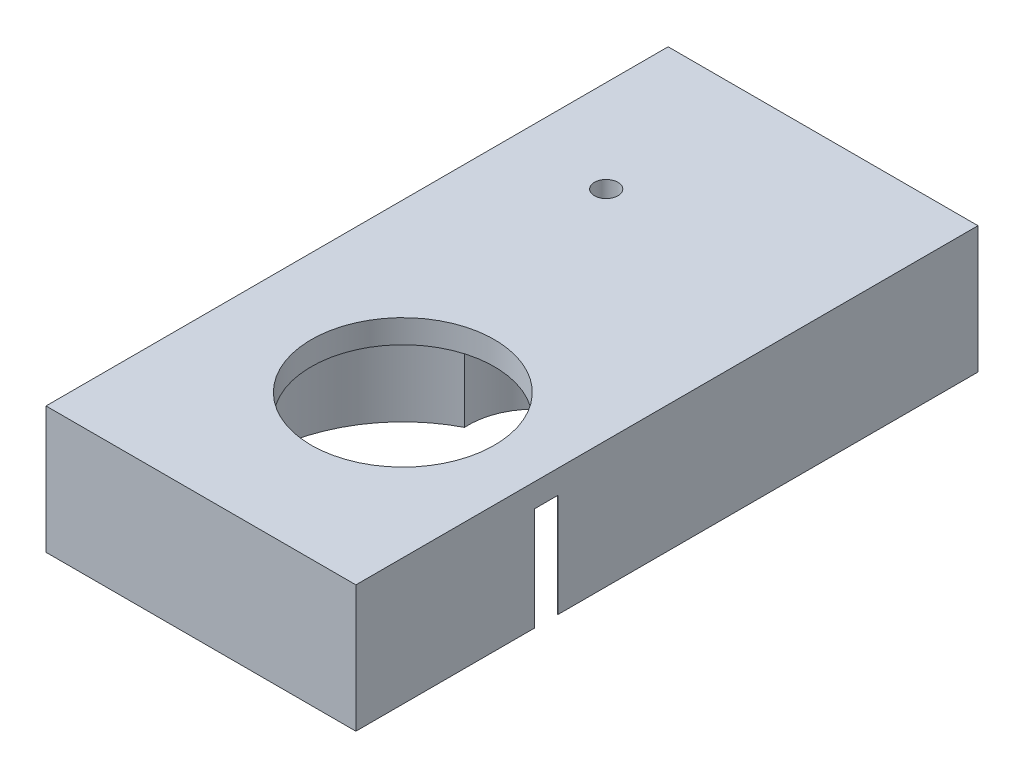
from build123d import *

# Parameters (mm, degrees)
BOSS_EXTRUDE1_DEPTH = 4.4
SKETCH2_R           = 0.5
CUT_EXTRUDE1_DEPTH  = 28.72093072
BOSS_EXTRUDE5_START = 1
SKETCH5_W           = 13.2
SKETCH5_H           = 26.5
SKETCH5_R           = 0.5
SKETCH5_R_2         = 3.9
BOSS_EXTRUDE5_DEPTH = 1


with BuildPart() as part:
    # Sketch1 → Boss-Extrude1 (new body)
    with BuildSketch(Plane(origin=(0, 0, 0), x_dir=(1, 0, 0), z_dir=(0, 1, 0))):
        with BuildLine():
            ThreePointArc((8.894356871, 11.522321429), (11.17380815, 9.48621778), (12.179473661, 6.6))
            Line((12.179473661, 6.6), (12.2, 6.6))
            Line((12.2, 6.6), (12.2, 22.5))
            Line((12.2, 22.5), (12.2, 24.5))
            Line((12.2, 24.5), (-1, 24.5))
            Line((-1, 24.5), (-1, -2))
            Line((-1, -2), (12.2, -2))
            Line((12.2, -2), (12.2, 0))
            Line((12.2, 0), (12.2, 5.6))
            Line((12.2, 5.6), (12.179473661, 5.6))
            ThreePointArc((12.179473661, 5.6), (2.71378222, 1.02619185), (3.305643129, 11.522321429))
            ThreePointArc((3.305643129, 11.522321429), (6.1, 14.5), (8.894356871, 11.522321429))
        make_face()
    extrude(amount=BOSS_EXTRUDE1_DEPTH)

    # Sketch2 → Cut-Extrude1 (cut, through all)
    with BuildSketch(Plane(origin=(0, 4.4, 0), x_dir=(1, 0, 0), z_dir=(0, 1, 0))):
        with Locations((2.929466697, 17.932591372)):
            Circle(SKETCH2_R)
    extrude(amount=-CUT_EXTRUDE1_DEPTH, mode=Mode.SUBTRACT)

    # Sketch5 → Boss-Extrude5 (add)
    with BuildSketch(Plane(origin=(0, 4.4, 0), x_dir=(1, 0, 0), z_dir=(0, 1, 0)).offset(BOSS_EXTRUDE5_START)):
        with Locations((5.6, 11.25)):
            Rectangle(SKETCH5_W, SKETCH5_H)
        with Locations((2.929466697, 17.932591372)):
            Circle(SKETCH5_R, mode=Mode.SUBTRACT)
        with Locations((6.1, 6.1)):
            Circle(SKETCH5_R_2, mode=Mode.SUBTRACT)
    extrude(amount=-BOSS_EXTRUDE5_DEPTH)


solid = part.part
